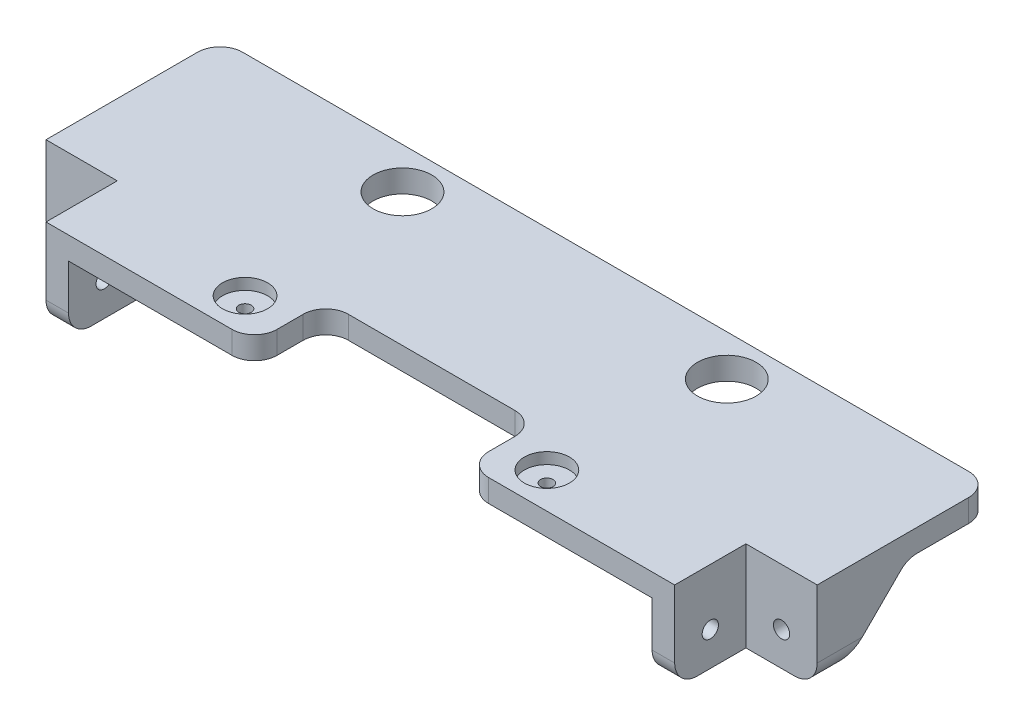
from build123d import *

# Parameters (mm, degrees)
SKETCH1_W            = 217.17
SKETCH1_H            = 49.022
BOSS_EXTRUDE1_DEPTH  = 6.35
SKETCH5_W            = 20.066
SKETCH5_H            = 25.4
BOSS_EXTRUDE3_DEPTH  = 6.35
SKETCH6_W            = 25.4
SKETCH6_H            = 20.066
BOSS_EXTRUDE4_DEPTH  = 6.35
SKETCH7_R            = 1.75
CUT_EXTRUDE1_DEPTH   = 119.914732704
SKETCH9_R            = 2.286
CUT_EXTRUDE2_DEPTH   = 119.213807607
BOSS_EXTRUDE8_DEPTH  = 3.175
BOSS_EXTRUDE9_START  = 1.2
SKETCH15_R           = 6.35
SKETCH15_R_2         = 1.75
BOSS_EXTRUDE9_DEPTH  = 1.2
CUT_EXTRUDE4_START   = -3.175
SKETCH16_R           = 6.35
CUT_EXTRUDE4_DEPTH   = 3.175
SKETCH17_R           = 8.255
CUT_EXTRUDE5_DEPTH   = 119.914732704
SKETCH18_W           = 33.319
SKETCH18_H           = 20.066
BOSS_EXTRUDE10_DEPTH = 6.35
SKETCH19_R           = 2.286
BOSS_EXTRUDE11_DEPTH = 6.35
BOSS_EXTRUDE12_START = 6.35
SKETCH20_W           = 26.416
SKETCH20_H           = 19.05
SKETCH20_R           = 2.286
BOSS_EXTRUDE12_DEPTH = 6.35
BOSS_EXTRUDE13_DEPTH = 3.175
BOSS_EXTRUDE14_DEPTH = 3.175
BOSS_EXTRUDE15_DEPTH = 6.35
BOSS_EXTRUDE16_DEPTH = 6.35
FILLET2_R            = 6.35
FILLET3_R            = 6.35


with BuildPart() as part:
    # Sketch1 → Boss-Extrude1 (new body)
    with BuildSketch(Plane(origin=(0, 0, 0), x_dir=(1, 0, 0), z_dir=(0, 1, 0))):
        Rectangle(SKETCH1_W, SKETCH1_H)
    extrude(amount=BOSS_EXTRUDE1_DEPTH)

    # Sketch5 → Boss-Extrude3 (add)
    with BuildSketch(Plane.XY.offset(24.511)):
        with Locations((-98.552, -6.35)):
            Rectangle(SKETCH5_W, SKETCH5_H)
        with Locations((98.552, -6.35)):
            Rectangle(SKETCH5_W, SKETCH5_H)
    extrude(amount=-BOSS_EXTRUDE3_DEPTH)

    # Sketch6 → Boss-Extrude4 (add)
    with BuildSketch(Plane(origin=(0, 0, 0), x_dir=(-1, 0, 0), z_dir=(0, -1, 0))):
        with Locations((42.5, -34.544)):
            Rectangle(SKETCH6_W, SKETCH6_H)
        with Locations((-42.5, -34.544)):
            Rectangle(SKETCH6_W, SKETCH6_H)
    extrude(amount=-BOSS_EXTRUDE4_DEPTH)

    # Sketch7 → Cut-Extrude1 (cut, through all)
    with BuildSketch(Plane.XZ):
        with Locations(Location((-42.5, 34.544, 0), (0, 0, 270))):
            Circle(SKETCH7_R)
        with Locations(Location((42.5, 34.544, 0), (0, 0, 270))):
            Circle(SKETCH7_R)
    extrude(amount=-CUT_EXTRUDE1_DEPTH, mode=Mode.SUBTRACT)

    # Sketch9 → Cut-Extrude2 (cut, through all)
    with BuildSketch(Plane(origin=(0, 0, 18.161), x_dir=(-1, 0, 0), z_dir=(0, 0, -1))):
        with Locations((98.552, -9.525)):
            Circle(SKETCH9_R)
        with Locations((-98.552, -9.525)):
            Circle(SKETCH9_R)
    extrude(amount=-CUT_EXTRUDE2_DEPTH, mode=Mode.SUBTRACT)

    # Sketch14 → Boss-Extrude8 (add)
    with BuildSketch(Plane.ZY.offset(108.585)):
        Polygon((-24.511, 6.35), (-24.511, 0), (18.161, 0), (18.161, -19.05), (24.511, -19.05), (24.511, 6.35), align=None)
    extrude(amount=-BOSS_EXTRUDE8_DEPTH)

    # Sketch15 → Boss-Extrude9 (add)
    # profile 1 of 2: a face of its own
    with BuildSketch(Plane.XZ.offset(BOSS_EXTRUDE9_START)):
        with Locations(Location((42.5, 34.544, 0), (0, 0, 270))):
            Circle(SKETCH15_R)
        with Locations(Location((42.5, 34.544, 0), (0, 0, 270))):
            Circle(SKETCH15_R_2, mode=Mode.SUBTRACT)
    # profile 2 of 2: a face of its own
    with BuildSketch(Plane.XZ.offset(BOSS_EXTRUDE9_START)):
        with Locations(Location((-42.5, 34.544, 0), (0, 0, 270))):
            Circle(SKETCH15_R)
        with Locations(Location((-42.5, 34.544, 0), (0, 0, 270))):
            Circle(SKETCH15_R_2, mode=Mode.SUBTRACT)
    extrude(amount=-BOSS_EXTRUDE9_DEPTH)

    # Sketch16 → Cut-Extrude4 (cut)
    with BuildSketch(Plane(origin=(0, 6.35, 0), x_dir=(1, 0, 0), z_dir=(0, 1, 0)).offset(CUT_EXTRUDE4_START)):
        with Locations(Location((42.5, -34.544, 0), (0, 0, 90))):
            Circle(SKETCH16_R)
        with Locations(Location((-42.5, -34.544, 0), (0, 0, 90))):
            Circle(SKETCH16_R)
    extrude(amount=CUT_EXTRUDE4_DEPTH, mode=Mode.SUBTRACT)

    # Sketch17 → Cut-Extrude5 (cut, through all)
    with BuildSketch(Plane.XZ):
        with Locations(Location((-45.675, -12.956, 0), (0, 0, 270))):
            Circle(SKETCH17_R)
        with Locations(Location((45.675, -12.956, 0), (0, 0, 270))):
            Circle(SKETCH17_R)
    extrude(amount=-CUT_EXTRUDE5_DEPTH, mode=Mode.SUBTRACT)

    # Sketch18 → Boss-Extrude10 (add)
    with BuildSketch(Plane.XZ):
        with Locations((71.8595, 34.544)):
            Rectangle(SKETCH18_W, SKETCH18_H)
        with Locations((-71.8595, 34.544)):
            Rectangle(SKETCH18_W, SKETCH18_H)
    extrude(amount=-BOSS_EXTRUDE10_DEPTH)

    # Sketch19 → Boss-Extrude11 (add)
    with BuildSketch(Plane.ZY.offset(-88.519)):
        Polygon((24.511, -19.05), (44.577, -19.05), (44.577, 0), (24.511, 0), (18.161, 0), (18.161, -19.05), align=None)
        with Locations((34.544, -9.525)):
            Circle(SKETCH19_R, mode=Mode.SUBTRACT)
    extrude(amount=BOSS_EXTRUDE11_DEPTH)

    # Sketch20 → Boss-Extrude12 (add)
    with BuildSketch(Plane(origin=(-88.519, 0, 0), x_dir=(0, 0, -1), z_dir=(1, 0, 0)).offset(BOSS_EXTRUDE12_START)):
        with Locations((-31.369, -9.525)):
            Rectangle(SKETCH20_W, SKETCH20_H)
        with Locations(Location((-34.544, -9.525, 0), (0, 0, 180))):
            Circle(SKETCH20_R, mode=Mode.SUBTRACT)
    extrude(amount=-BOSS_EXTRUDE12_DEPTH)

    # Sketch21 → Boss-Extrude13 (add)
    with BuildSketch(Plane.ZY.offset(108.585)):
        Polygon((18.161, -19.05), (-0.889, 0), (18.161, 0), align=None)
    extrude(amount=-BOSS_EXTRUDE13_DEPTH)

    # Sketch22 → Boss-Extrude14 (add)
    with BuildSketch(Plane(origin=(108.585, 0, 0), x_dir=(0, 0, -1), z_dir=(1, 0, 0))):
        Polygon((-18.161, 0), (-18.161, -19.05), (0.889, 0), align=None)
    extrude(amount=-BOSS_EXTRUDE14_DEPTH)

    # Sketch23 → Boss-Extrude15 (add)
    with BuildSketch(Plane(origin=(-82.169, 0, 0), x_dir=(0, 0, -1), z_dir=(1, 0, 0))):
        Polygon((-18.161, 0), (-18.161, -19.05), (0.889, 0), align=None)
    extrude(amount=-BOSS_EXTRUDE15_DEPTH)

    # Sketch24 → Boss-Extrude16 (add)
    with BuildSketch(Plane.ZY.offset(-82.169)):
        Polygon((18.161, 0), (-0.889, 0), (18.161, -19.05), align=None)
    extrude(amount=-BOSS_EXTRUDE16_DEPTH)

    # Fillet2
    fillet2_edges = [part.edges().sort_by_distance(p)[0] for p in [
        (85.344, -19.05, 44.577),
        (-85.344, -19.05, 44.577),
        (-29.8, 3.175, 44.577),
        (-29.8, 3.175, 24.511),
        (29.8, 3.175, 24.511),
        (29.8, 3.175, 44.577),
    ]]
    fillet(fillet2_edges, radius=FILLET2_R)

    # Fillet3
    # the kernel refuses this fillet: 6.35 mm, written as the material it adds along each edge
    with BuildSketch(Plane(origin=(-108.585, 0, -0.889), x_dir=(0, 0, -1), z_dir=(1, 0, 0))) as fillet3_piece_1:
        with BuildLine():
            CenterArc((FILLET3_R * 0.414213562373, -FILLET3_R), FILLET3_R, 90, 45)
            Line((-FILLET3_R * 0.292893218813, -FILLET3_R * 0.292893218813), (0, 0))
            Line((0, 0), (FILLET3_R * 0.414213562373, 0))
        make_face()
    extrude(amount=3.175)
    with BuildSketch(Plane(origin=(108.585, 0, -0.889), x_dir=(0, 0, -1), z_dir=(-1, 0, 0))) as fillet3_piece_2:
        with BuildLine():
            CenterArc((FILLET3_R * 0.414213562373, FILLET3_R), FILLET3_R, 225, 45)
            Line((-FILLET3_R * 0.292893218813, FILLET3_R * 0.292893218813), (0, 0))
            Line((0, 0), (FILLET3_R * 0.414213562373, 0))
        make_face()
    extrude(amount=3.175)
    with BuildSketch(Plane(origin=(-82.169, 0, -0.889), x_dir=(0, 0, -1), z_dir=(-1, 0, 0))) as fillet3_piece_3:
        with BuildLine():
            CenterArc((FILLET3_R * 0.414213562373, FILLET3_R), FILLET3_R, 225, 45)
            Line((-FILLET3_R * 0.292893218813, FILLET3_R * 0.292893218813), (0, 0))
            Line((0, 0), (FILLET3_R * 0.414213562373, 0))
        make_face()
    extrude(amount=6.35)
    with BuildSketch(Plane(origin=(82.169, 0, -0.889), x_dir=(0, 0, -1), z_dir=(1, 0, 0))) as fillet3_piece_4:
        with BuildLine():
            CenterArc((FILLET3_R * 0.414213562373, -FILLET3_R), FILLET3_R, 90, 45)
            Line((-FILLET3_R * 0.292893218813, -FILLET3_R * 0.292893218813), (0, 0))
            Line((0, 0), (FILLET3_R * 0.414213562373, 0))
        make_face()
    extrude(amount=6.35)
    # the kernel refuses this fillet: 6.35 mm, written as the material it takes off along each edge
    with BuildSketch(Plane(origin=(-108.585, -19.05, 40.386), x_dir=(1, 0, 0), z_dir=(0, 0, -1))) as fillet3_2_piece_1:
        with BuildLine():
            CenterArc((FILLET3_R, -FILLET3_R), FILLET3_R, 90, 90)
            Line((0, -FILLET3_R), (0, 0))
            Line((0, 0), (FILLET3_R, 0))
        make_face()
    extrude(amount=38.1, mode=Mode.SUBTRACT)
    with BuildSketch(Plane(origin=(108.585, -19.05, 40.386), x_dir=(-1, 0, 0), z_dir=(0, 0, -1)), Plane(origin=(-108.585, -15.875, -24.511), x_dir=(0, 0, 1), z_dir=(0, 1, 0)), Plane(origin=(108.585, -15.875, -24.511), x_dir=(-1, 0, 0), z_dir=(0, 1, 0))) as fillet3_2_piece_2:
        with BuildLine():
            CenterArc((FILLET3_R, FILLET3_R), FILLET3_R, 180, 90)
            Line((0, FILLET3_R), (0, 0))
            Line((0, 0), (FILLET3_R, 0))
        make_face()
    extrude(amount=38.1, mode=Mode.SUBTRACT)


solid = part.part
